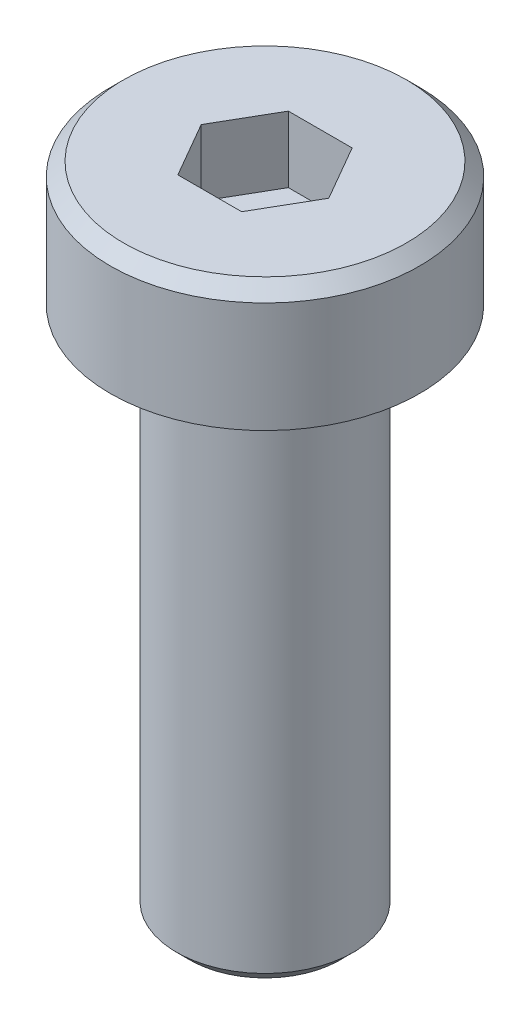
from build123d import *

# Parameters (mm, degrees)
CUT_EXTRUDE_322_DEPTH = 1.5


with BuildPart() as part:
    # Sketch 184 → Revolve 223 (revolve)
    with BuildSketch(Plane.XY):
        Polygon((0, -12), (1.7, -12), (2, -11.7), (2, 0), (3.5, 0), (3.5, 2.5), (3.2, 2.8), (0, 2.8), align=None)
    revolve(axis=Axis((0, -14, 0), (0, 1, 0)))

    # Sketch 274 → Cut-Extrude 322 (cut)
    with BuildSketch(Plane(origin=(0, 2.8, 0), x_dir=(1, 0, 0), z_dir=(0, 1, 0))):
        Polygon((1.443375673, 0), (0.721687836, 1.25), (-0.721687836, 1.25), (-1.443375673, 0), (-0.721687836, -1.25), (0.721687836, -1.25), align=None)
    extrude(amount=-CUT_EXTRUDE_322_DEPTH, mode=Mode.SUBTRACT)


solid = part.part
